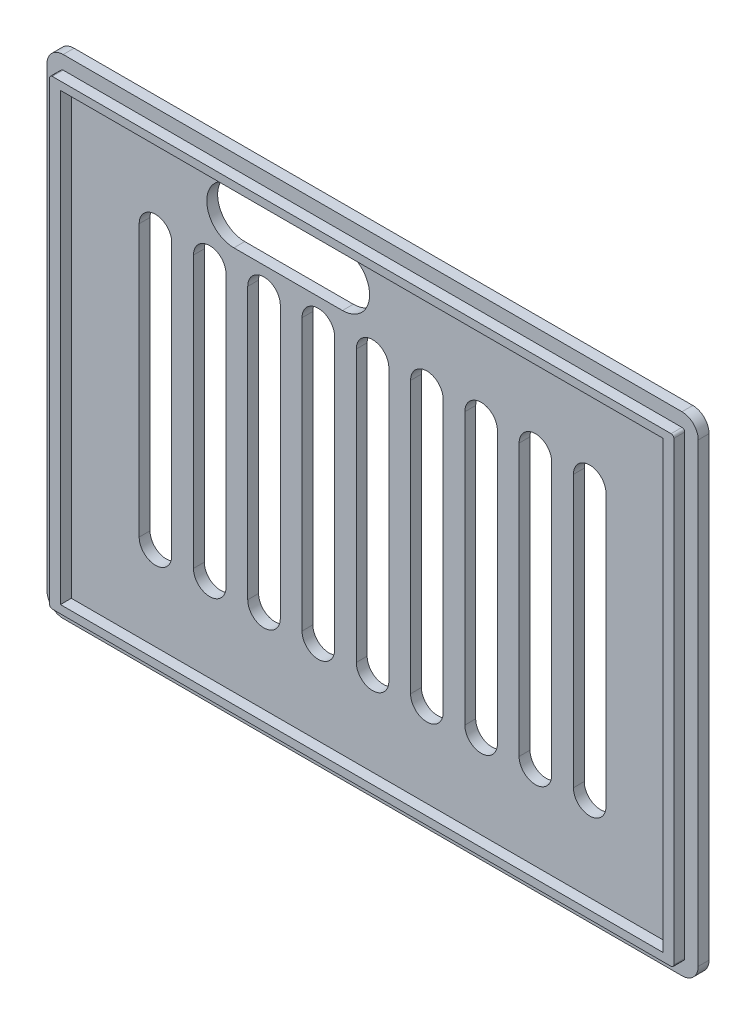
from build123d import *

# Parameters (mm, degrees)
ESQUISSE1_W                     = 120
ESQUISSE1_H                     = 90
BOSS_EXTRU_1_DEPTH              = 2
ESQUISSE2_W                     = 115
ESQUISSE2_H                     = 85
ESQUISSE2_W_2                   = 111
ESQUISSE2_H_2                   = 82.04347826
BOSS_EXTRU_2_DEPTH              = 2
ENL_V_MAT_EXTRU_1_DEPTH         = 2
CONG_1_R                        = 3
CONG_2_R                        = 0.5
ENL_V_MAT_EXTRU_2_DEPTH         = 76.106590923
R_P_TITION_LIN_AIRE1_COUNT      = 5
R_P_TITION_LIN_AIRE1_PITCH      = 10
R_P_TITION_LIN_AIRE1_COUNT_DIR2 = 5
R_P_TITION_LIN_AIRE1_PITCH_DIR2 = 10


with BuildPart() as part:
    # Esquisse1 → Boss.-Extru.1 (new body)
    with BuildSketch(Plane.XY):
        Rectangle(ESQUISSE1_W, ESQUISSE1_H)
    extrude(amount=BOSS_EXTRU_1_DEPTH)

    # Esquisse2 → Boss.-Extru.2 (add)
    with BuildSketch(Plane.XY.offset(2)):
        Rectangle(ESQUISSE2_W, ESQUISSE2_H)
        Rectangle(ESQUISSE2_W_2, ESQUISSE2_H_2, mode=Mode.SUBTRACT)
    extrude(amount=BOSS_EXTRU_2_DEPTH)

    # Esquisse3 → Enlèv. mat.-Extru.1 (cut)
    with BuildSketch(Plane(origin=(0, 0, 0), x_dir=(-1, 0, 0), z_dir=(0, 0, -1))):
        with BuildLine():
            Line((5.548380707, 39.874958244), (25.548380707, 39.874958244))
            ThreePointArc((25.548380707, 39.874958244), (30.548380707, 34.874958244), (25.548380707, 29.874958244))
            Line((25.548380707, 29.874958244), (5.548380707, 29.874958244))
            ThreePointArc((5.548380707, 29.874958244), (0.548380707, 34.874958244), (5.548380707, 39.874958244))
        make_face()
    extrude(amount=-ENL_V_MAT_EXTRU_1_DEPTH, mode=Mode.SUBTRACT)

    # Congé1
    cong_1_edges = [part.edges().sort_by_distance(p)[0] for p in [
        (60, 45, 1),
        (-60, -45, 1),
        (-60, 45, 1),
        (60, -45, 1),
    ]]
    fillet(cong_1_edges, radius=CONG_1_R)

    # Congé2
    cong_2_edges = [part.edges().sort_by_distance(p)[0] for p in [
        (57.5, -42.5, 3),
        (57.5, 42.5, 3),
        (-57.5, 42.5, 3),
        (-57.5, -42.5, 3),
    ]]
    fillet(cong_2_edges, radius=CONG_2_R)

    # Esquisse4 → Enlèv. mat.-Extru.2 (cut, through all)
    with BuildSketch(Plane(origin=(0, 0, 0), x_dir=(-1, 0, 0), z_dir=(0, 0, -1))):
        with BuildLine():
            Line((3, 25), (3, -25))
            ThreePointArc((3, -25), (0, -28), (-3, -25))
            Line((-3, -25), (-3, 25))
            ThreePointArc((-3, 25), (0, 28), (3, 25))
        make_face()
    enl_v_mat_extru_2 = extrude(amount=-ENL_V_MAT_EXTRU_2_DEPTH, mode=Mode.SUBTRACT)

    # Répétition linéaire1: Enl_v. mat.-Extru.2 5 × 5
    with Locations(*[Vector(-1, 0, 0) * (i * R_P_TITION_LIN_AIRE1_PITCH) + Vector(1, 0, 0) * (j * R_P_TITION_LIN_AIRE1_PITCH_DIR2) for i in range(R_P_TITION_LIN_AIRE1_COUNT) for j in range(R_P_TITION_LIN_AIRE1_COUNT_DIR2) if (i, j) != (0, 0)]):
        add(enl_v_mat_extru_2, mode=Mode.SUBTRACT)


solid = part.part
